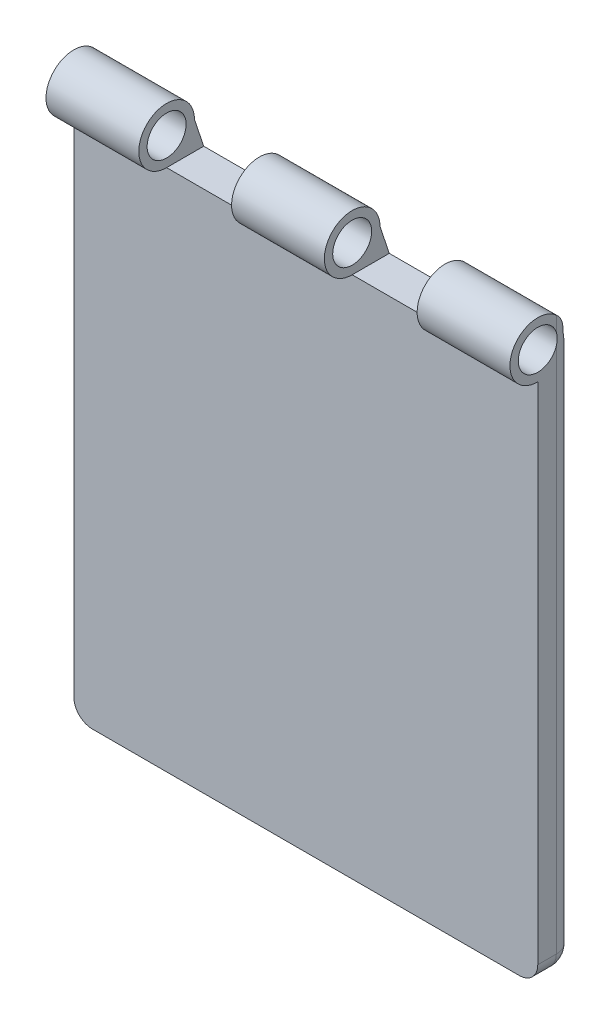
from build123d import *

# Parameters (mm, degrees)
SKETCH1_W           = 25
SKETCH1_H           = 28.2
BOSS_EXTRUDE1_DEPTH = 2
BOSS_EXTRUDE2_DEPTH = 5
LPATTERN1_COUNT     = 3
LPATTERN1_PITCH     = 10
SKETCH6_R           = 1.050000034
CUT_EXTRUDE1_DEPTH  = 31.490326335
FILLET1_R           = 1
FILLET2_R           = 1


with BuildPart() as part:
    # Sketch1 → Boss-Extrude1 (new body)
    with BuildSketch(Plane.XY):
        Rectangle(SKETCH1_W, SKETCH1_H)
    extrude(amount=BOSS_EXTRUDE1_DEPTH)

    # Sketch5 → Boss-Extrude2 (add)
    with BuildSketch(Plane.ZY.offset(12.5)):
        with BuildLine():
            Line((0.5, 15.6), (0, 14.1))
            Line((0, 14.1), (2, 14.1))
            ThreePointArc((2, 14.1), (3.060660172, 16.660660172), (0.5, 15.6))
        make_face()
    boss_extrude2 = extrude(amount=-BOSS_EXTRUDE2_DEPTH)

    # LPattern1: Boss-Extrude2 ×3
    with Locations(*[(i * LPATTERN1_PITCH, 0, 0) for i in range(1, LPATTERN1_COUNT)]):
        add(boss_extrude2)

    # Sketch6 → Cut-Extrude1 (cut, through all)
    with BuildSketch(Plane.ZY.offset(12.5)):
        with Locations((2, 15.6)):
            Circle(SKETCH6_R)
    extrude(amount=-CUT_EXTRUDE1_DEPTH, mode=Mode.SUBTRACT)

    # Fillet1
    # the kernel refuses this fillet: 1 mm, written as the material it takes off along each edge
    with BuildSketch(Plane(origin=(12.5, -20.1, 0), x_dir=(0, 0, 1), z_dir=(0, 1, 0)), Plane(origin=(-12.5, 20.1, 0), x_dir=(0, 0, 1), z_dir=(0, -1, 0))) as fillet1_piece_1:
        with BuildLine():
            CenterArc((FILLET1_R, -FILLET1_R), FILLET1_R, 90, 90)
            Line((0, -FILLET1_R), (-FILLET1_R * 0.02, -FILLET1_R))
            Line((-FILLET1_R * 0.02, -FILLET1_R), (-FILLET1_R * 0.02, FILLET1_R * 0.02))
            Line((-FILLET1_R * 0.02, FILLET1_R * 0.02), (FILLET1_R, FILLET1_R * 0.02))
            Line((FILLET1_R, FILLET1_R * 0.02), (FILLET1_R, 0))
        make_face()
    extrude(amount=40.2, mode=Mode.SUBTRACT)
    with BuildSketch(Plane(origin=(-18.5, -14.1, 0), x_dir=(0, 0, 1), z_dir=(1, 0, 0))) as fillet1_piece_2:
        with BuildLine():
            CenterArc((FILLET1_R, -FILLET1_R), FILLET1_R, 90, 90)
            Line((0, -FILLET1_R), (-FILLET1_R * 0.02, -FILLET1_R))
            Line((-FILLET1_R * 0.02, -FILLET1_R), (-FILLET1_R * 0.02, FILLET1_R * 0.02))
            Line((-FILLET1_R * 0.02, FILLET1_R * 0.02), (FILLET1_R, FILLET1_R * 0.02))
            Line((FILLET1_R, FILLET1_R * 0.02), (FILLET1_R, 0))
        make_face()
    extrude(amount=37, mode=Mode.SUBTRACT)

    # Fillet2
    # the kernel refuses this fillet: 1 mm, written as the material it takes off along each edge
    with BuildSketch(Plane(origin=(-11.5, -13.1, 1), x_dir=(-1, 0, 0), z_dir=(0, -1, 0))) as fillet2_piece_1_section:
        Polygon((0, 0), (FILLET2_R, 0), (FILLET2_R, FILLET2_R), (0, FILLET2_R), align=None)
    fillet2_piece_1 = extrude(amount=FILLET2_R, mode=Mode.PRIVATE)
    fillet2_piece_1 = fillet2_piece_1 - Plane(origin=(-11.5, -13.1, 1), x_dir=(0.7071067811865475, 0, 0.7071067811865475), z_dir=(0, -1, 0)) * Sphere(FILLET2_R, mode=Mode.PRIVATE)
    add(fillet2_piece_1, mode=Mode.SUBTRACT)
    with BuildSketch(Plane(origin=(11.5, -13.1, 1), x_dir=(1, 0, 0), z_dir=(0, -1, 0))) as fillet2_piece_2_section:
        Polygon((0, 0), (FILLET2_R, 0), (FILLET2_R, -FILLET2_R), (0, -FILLET2_R), align=None)
    fillet2_piece_2 = extrude(amount=FILLET2_R, mode=Mode.PRIVATE)
    fillet2_piece_2 = fillet2_piece_2 - Plane(origin=(11.5, -13.1, 1), x_dir=(-0.7071067811865475, 0, 0.7071067811865475), z_dir=(0, -1, 0)) * Sphere(FILLET2_R, mode=Mode.PRIVATE)
    add(fillet2_piece_2, mode=Mode.SUBTRACT)
    with BuildSketch(Plane(origin=(12.5, -14.1, 1), x_dir=(-1, 0, 0), z_dir=(0, 0, 1))) as fillet2_piece_3:
        with BuildLine():
            CenterArc((FILLET2_R, -FILLET2_R), FILLET2_R, 90, 90)
            Line((0, -FILLET2_R), (0, 0))
            Line((0, 0), (FILLET2_R, 0))
        make_face()
    extrude(amount=3.5, mode=Mode.SUBTRACT)
    with BuildSketch(Plane(origin=(-12.5, -14.1, 1), x_dir=(1, 0, 0), z_dir=(0, 0, 1))) as fillet2_piece_4:
        with BuildLine():
            CenterArc((FILLET2_R, FILLET2_R), FILLET2_R, 180, 90)
            Line((0, FILLET2_R), (0, 0))
            Line((0, 0), (FILLET2_R, 0))
        make_face()
    extrude(amount=3.5, mode=Mode.SUBTRACT)


solid = part.part
